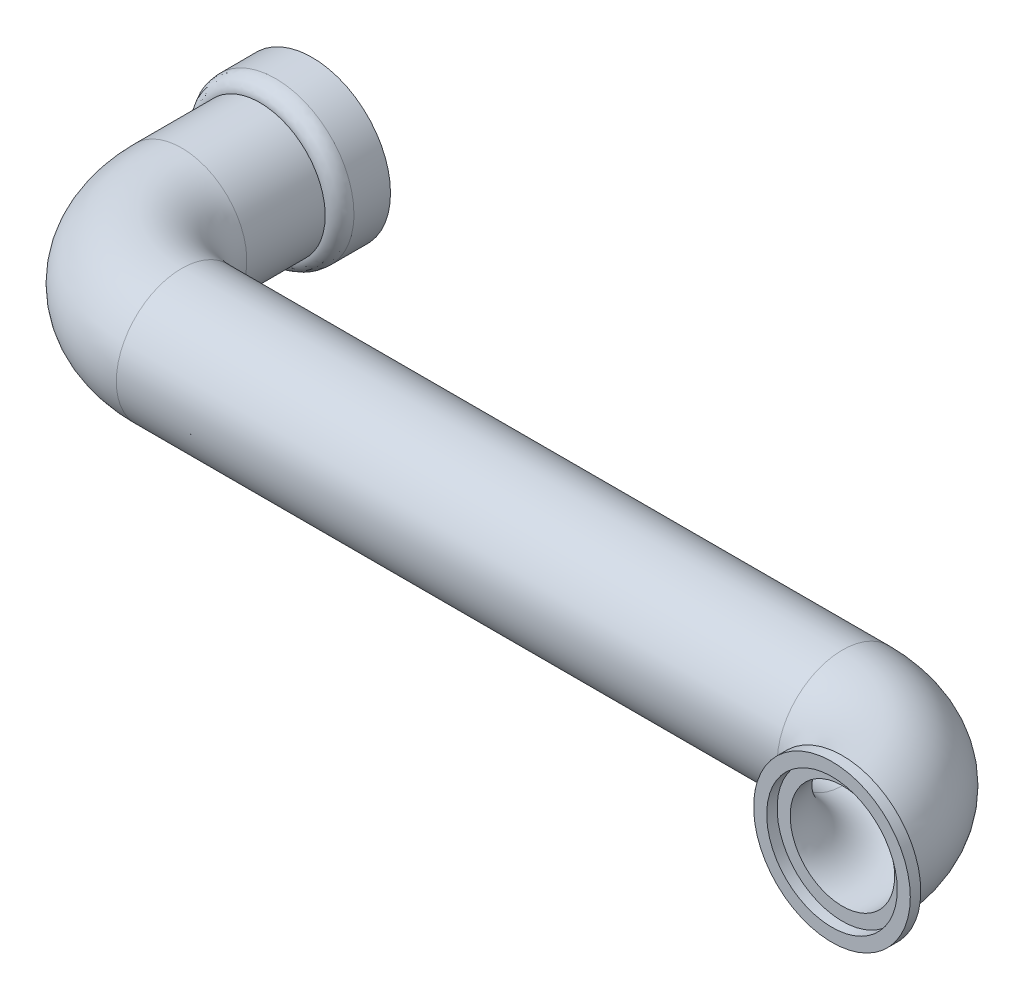
from build123d import *

# Parameters (mm, degrees)
CROQUIS1_R              = 15
CROQUIS1_R_2            = 12.5
SALIENTE_EXTRUIR1_DEPTH = 10
CROQUIS2_R              = 12.5
CROQUIS2_R_2            = 10
SALIENTE_EXTRUIR2_DEPTH = 15
REDONDEO3_SIZE          = 3
REDONDEO3_SIZE_2        = 2.5
SALIENTE_EXTRUIR3_START = 1
CROQUIS3_R              = 12.5
CROQUIS3_R_2            = 10
SALIENTE_EXTRUIR3_DEPTH = 1
CROQUIS6_R              = 12.5
CROQUIS6_R_2            = 10
CROQUIS7_R              = 15
CROQUIS7_R_2            = 12.5
SALIENTE_EXTRUIR4_DEPTH = 2


with BuildPart() as part:
    # Croquis1 → Saliente-Extruir1 (new body)
    with BuildSketch(Plane.XY):
        Circle(CROQUIS1_R)
        Circle(CROQUIS1_R_2, mode=Mode.SUBTRACT)
    extrude(amount=SALIENTE_EXTRUIR1_DEPTH)

    # Redondeo3
    # an asymmetric fillet: 3, 2.5 mm, written as the material it takes off along each edge
    with BuildSketch(Plane(origin=(0, 0, 10), x_dir=(1, 0, 0), z_dir=(0, -1, 0))) as redondeo3_piece_1:
        with BuildLine():
            Bezier((15, -REDONDEO3_SIZE), (15, 0), (15 - REDONDEO3_SIZE_2, 0), weights=[1, 0.707106781, 1])
            Line((15 - REDONDEO3_SIZE_2, 0), (15, 0))
            Line((15, 0), (15, -REDONDEO3_SIZE))
        make_face()
    revolve(axis=Axis((0, 0, 10), (0, 0, 1)), mode=Mode.SUBTRACT)



with BuildPart() as body_2:
    # Croquis2 → Saliente-Extruir2 (new body)
    with BuildSketch(Plane.XY.offset(10)):
        Circle(CROQUIS2_R)
        Circle(CROQUIS2_R_2, mode=Mode.SUBTRACT)
    extrude(amount=SALIENTE_EXTRUIR2_DEPTH)


with BuildPart() as part_1:
    add(part.part)

    add(body_2.part)  # Saliente-Extruir3 merges body 2
    # Croquis3 → Saliente-Extruir3 (add)
    with BuildSketch(Plane(origin=(0, 0, 10), x_dir=(-1, 0, 0), z_dir=(0, 0, -1)).offset(SALIENTE_EXTRUIR3_START)):
        Circle(CROQUIS3_R)
        with Locations(Location((0, 0, 0), (0, 0, 180))):
            Circle(CROQUIS3_R_2, mode=Mode.SUBTRACT)
    extrude(amount=-SALIENTE_EXTRUIR3_DEPTH)

    # Barrer1: sweep along a path in Croquis5
    with BuildLine(Plane(origin=(0, 0, 0), x_dir=(1, 0, 0), z_dir=(0, 1, 0))) as barrer1_path:
        ThreePointArc((0, -25), (5.857864376, -39.142135624), (20, -45))
        Line((20, -45), (146.5317248, -45))
        ThreePointArc((146.5317248, -45), (160.673860424, -50.857864376), (166.5317248, -65))
    # Croquis6 → Barrer1 (sweep)
    with BuildSketch(Plane.XY.offset(25)):
        Circle(CROQUIS6_R)
        Circle(CROQUIS6_R_2, mode=Mode.SUBTRACT)
    sweep(path=barrer1_path.line)


with BuildPart() as body_2_2:
    # Croquis7 → Saliente-Extruir4 (new body)
    with BuildSketch(Plane.XY.offset(65)):
        with Locations((166.5317248, 0)):
            Circle(CROQUIS7_R)
        with Locations((166.5317248, 0)):
            Circle(CROQUIS7_R_2, mode=Mode.SUBTRACT)
    extrude(amount=SALIENTE_EXTRUIR4_DEPTH)


solid = Compound([part_1.part, body_2_2.part])
